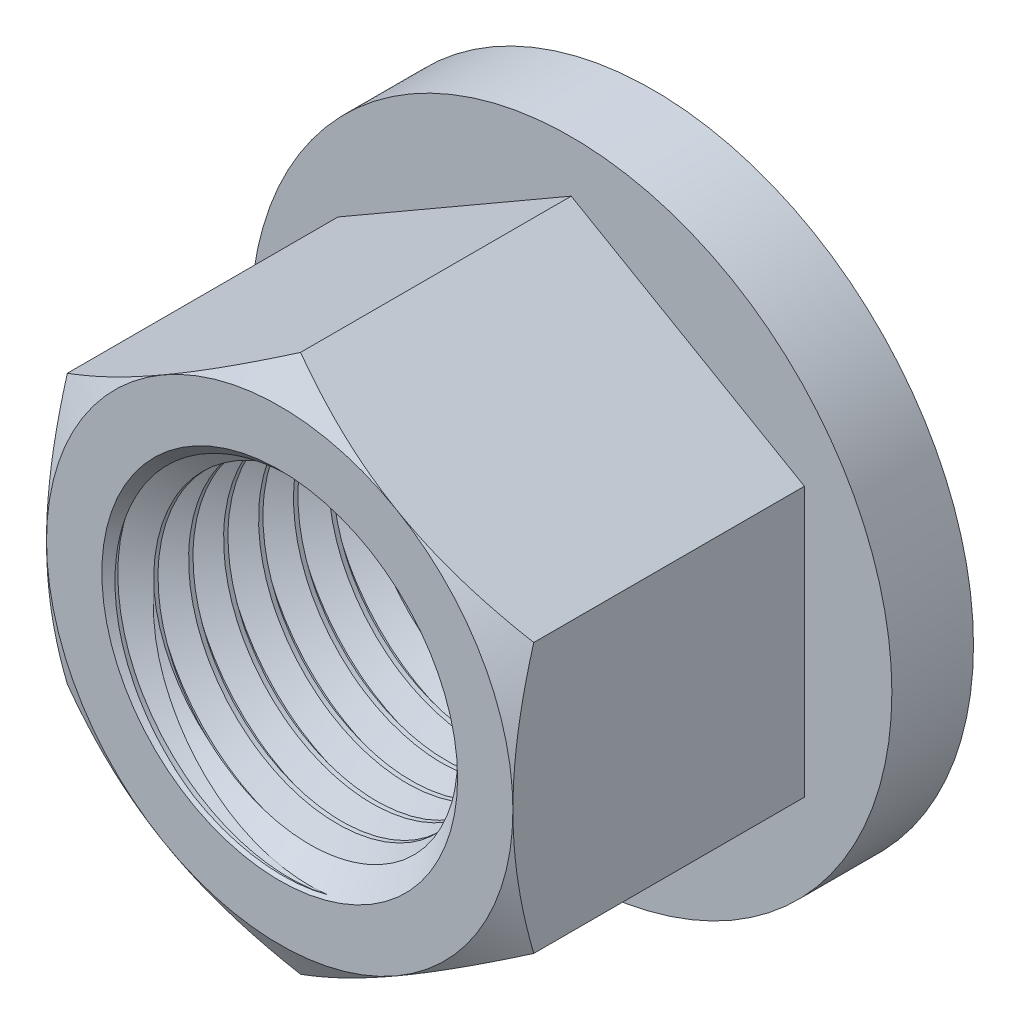
from build123d import *

# Parameters (mm, degrees)
EXTRUDE1_DEPTH     = 32
SKETCH13_R         = 27.5
EXTRUDE3_DEPTH     = 7
SKETCH2_OUTSIDE_W  = 251.75
SKETCH2_OUTSIDE_H  = 251.75
SKETCH2_OUTSIDE_R  = 20
CUT_EXTRUDE1_DEPTH = 51.363677388
CUT_EXTRUDE1_DRAFT = -60
SKETCH4_R          = 15
CUT_EXTRUDE3_DEPTH = 51.363677388
SKETCH12_R         = 15
SKETCH12_R_2       = 13.051442841
EXTRUDE2_DEPTH     = 32
CUT_SWEEP1_PITCH   = 3


with BuildPart() as part:
    # Sketch1 → Extrude1 (new body)
    with BuildSketch(Plane.XY):
        Polygon((0, 23.094010768), (-20, 11.547005384), (-20, -11.547005384), (0, -23.094010768), (20, -11.547005384), (20, 11.547005384), align=None)
    extrude(amount=-EXTRUDE1_DEPTH)

    # Sketch13 → Extrude3 (add)
    with BuildSketch(Plane(origin=(0, 0, -32), x_dir=(-1, 0, 0), z_dir=(0, 0, -1))):
        Circle(SKETCH13_R)
    extrude(amount=-EXTRUDE3_DEPTH)


with BuildPart() as cut_extrude1_tool:
    # Sketch2 outside → Cut-Extrude1 (with draft: the straight prism first)
    with BuildSketch(Plane.XY):
        Rectangle(SKETCH2_OUTSIDE_W, SKETCH2_OUTSIDE_H)
        Circle(SKETCH2_OUTSIDE_R, mode=Mode.SUBTRACT)
    extrude(amount=-CUT_EXTRUDE1_DEPTH)
    # Cut-Extrude1: the draft: its side faces are tilted about the plane it starts from
    cut_extrude1_sides = [cut_extrude1_tool.faces().sort_by_distance(p)[0] for p in [
        (0, -125.875, -25.681838694),
        (125.875, 0, -25.681838694),
        (0, 125.875, -25.681838694),
        (-125.875, 0, -25.681838694),
        (-20, 0, -25.681838694),
    ]]
    draft(cut_extrude1_sides, Plane.XY, CUT_EXTRUDE1_DRAFT)


with BuildPart() as part_1:
    add(part.part)

    # Cut-Extrude1: cut by cut_extrude1_tool
    add(cut_extrude1_tool.part, mode=Mode.SUBTRACT)

    # Sketch4 → Cut-Extrude3 (cut, through all)
    with BuildSketch(Plane.XY):
        Circle(SKETCH4_R)
    extrude(amount=-CUT_EXTRUDE3_DEPTH, mode=Mode.SUBTRACT)

    # Sketch12 → Extrude2 (add)
    with BuildSketch(Plane.XY):
        Circle(SKETCH12_R)
        Circle(SKETCH12_R_2, mode=Mode.SUBTRACT)
    extrude(amount=-EXTRUDE2_DEPTH)

    # Cut-Sweep1: the profile of Sketch9 profile screwed along a right-hand helix of 11.666667 turns, 6 arcs to a turn; built about Z, then put on its axis
    cut_sweep1_z = Axis((0, 0, 0), (0, 0, 1))
    cut_sweep1_corners = [(15, 0, -1.5), (15, 0, -1.125), (13.051142841, 0, 0.000173205), (13.051142841, 0, -2.625173205)]
    with BuildLine(mode=Mode.PRIVATE) as cut_sweep1_profile:
        Line(cut_sweep1_corners[0], cut_sweep1_corners[1])
        Line(cut_sweep1_corners[1], cut_sweep1_corners[2])
        Line(cut_sweep1_corners[2], cut_sweep1_corners[3])
        Line(cut_sweep1_corners[3], cut_sweep1_corners[0])
    cut_sweep1_cap = Face(cut_sweep1_profile.wire())
    cut_sweep1_turn_angles = [0, 30, 60, 90, 120, 150, 180, 210, 240, 270, 300, 330, 360]
    cut_sweep1_turn_weights = [1, 0.8660254037844387, 1, 0.8660254037844387, 1, 0.8660254037844387, 1, 0.8660254037844387, 1, 0.8660254037844387, 1, 0.8660254037844387, 1]
    cut_sweep1_turn_rails = [Edge.make_bspline([Vector(p[0], p[1], 0).rotate(cut_sweep1_z, cut_sweep1_turn_angles[k]) / cut_sweep1_turn_weights[k] + Vector(0, 0, p[2] + CUT_SWEEP1_PITCH * cut_sweep1_turn_angles[k] / 360) for k in range(13)], [0, 0, 0, 1, 1, 2, 2, 3, 3, 4, 4, 5, 5, 6, 6, 6], 2, cut_sweep1_turn_weights) for p in cut_sweep1_corners]
    cut_sweep1_turn_sides = [Face.make_surface_from_curves(cut_sweep1_turn_rails[p[0]], cut_sweep1_turn_rails[p[1]]) for p in [(0, 1), (1, 2), (2, 3), (3, 0)]]
    cut_sweep1_last_angles = [3960, 3990, 4020, 4050, 4080, 4110, 4140, 4170, 4200]
    cut_sweep1_last_weights = [1, 0.8660254037844387, 1, 0.8660254037844387, 1, 0.8660254037844387, 1, 0.8660254037845061, 1]
    cut_sweep1_last_rails = [Edge.make_bspline([Vector(p[0], p[1], 0).rotate(cut_sweep1_z, cut_sweep1_last_angles[k]) / cut_sweep1_last_weights[k] + Vector(0, 0, p[2] + CUT_SWEEP1_PITCH * cut_sweep1_last_angles[k] / 360) for k in range(9)], [0, 0, 0, 1, 1, 2, 2, 3, 3, 4, 4, 4], 2, cut_sweep1_last_weights) for p in cut_sweep1_corners]
    cut_sweep1_last_sides = [Face.make_surface_from_curves(cut_sweep1_last_rails[p[0]], cut_sweep1_last_rails[p[1]]) for p in [(0, 1), (1, 2), (2, 3), (3, 0)]]
    cut_sweep1 = Plane(origin=(0, 0, 0), x_dir=(0, 1, 0), z_dir=(0, 0, -1)) * Solid(Shell([*[p.moved(Location((0, 0, CUT_SWEEP1_PITCH * i))) for i in range(11) for p in cut_sweep1_turn_sides], *cut_sweep1_last_sides, cut_sweep1_cap, cut_sweep1_cap.rotate(cut_sweep1_z, 4200).moved(Location((0, 0, CUT_SWEEP1_PITCH * 4200 / 360)))]))
    add(cut_sweep1, mode=Mode.SUBTRACT)

    # Cut-Extrude6 cone 1 section (through the dimple's axis) → Cut-Extrude6 (revolve, cut)
    with BuildSketch(Plane(origin=(0, 0, 0), x_dir=(0, -1, 0), z_dir=(1, 0, 0))):
        Polygon((0, 0), (15.254, 0), (0, 15.254), align=None)
    revolve(axis=Axis((0, 0, 0), (0, 0, -1)), mode=Mode.SUBTRACT)

    # Cut-Extrude7 cone 1 section (through the dimple's axis) → Cut-Extrude7 (revolve, cut)
    with BuildSketch(Plane(origin=(0, 0, -32), x_dir=(0, 1, 0), z_dir=(1, 0, 0))):
        Polygon((0, 0), (15.254, 0), (0, 15.254), align=None)
    revolve(axis=Axis((0, 0, -32), (0, 0, 1)), mode=Mode.SUBTRACT)


solid = part_1.part
